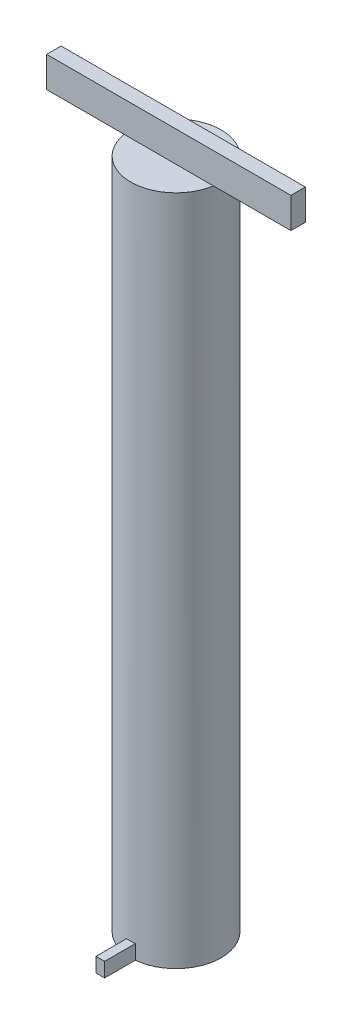
from build123d import *

# Parameters (mm, degrees)
SKETCH1_R           = 9.398
BOSS_EXTRUDE1_DEPTH = 139.7
BOSS_EXTRUDE2_DEPTH = 3
SKETCH4_W           = 50.8
SKETCH4_H           = 3
BOSS_EXTRUDE3_DEPTH = 6.35
SKETCH5_R           = 2.5
CUT_EXTRUDE1_DEPTH  = 2.54


with BuildPart() as part:
    # Sketch1 → Boss-Extrude1 (new body)
    with BuildSketch(Plane(origin=(0, 0, 0), x_dir=(1, 0, 0), z_dir=(0, 1, 0))):
        Circle(SKETCH1_R)
    extrude(amount=BOSS_EXTRUDE1_DEPTH)

    # Sketch3 → Boss-Extrude2 (add)
    with BuildSketch(Plane.XZ):
        with BuildLine():
            Line((-0.9, 15.75), (0.9, 15.75))
            Line((0.9, 15.75), (0.9, 9.354806465))
            ThreePointArc((0.9, 9.354806465), (0, 9.398), (-0.9, 9.354806465))
            Line((-0.9, 9.354806465), (-0.9, 15.75))
        make_face()
    extrude(amount=-BOSS_EXTRUDE2_DEPTH)

    # Sketch4 → Boss-Extrude3 (add)
    with BuildSketch(Plane(origin=(0, 139.7, 0), x_dir=(1, 0, 0), z_dir=(0, 1, 0))):
        Rectangle(SKETCH4_W, SKETCH4_H)
    extrude(amount=BOSS_EXTRUDE3_DEPTH)

    # Sketch5 → Cut-Extrude1 (cut)
    with BuildSketch(Plane.XZ):
        Circle(SKETCH5_R)
    extrude(amount=-CUT_EXTRUDE1_DEPTH, mode=Mode.SUBTRACT)


solid = part.part
